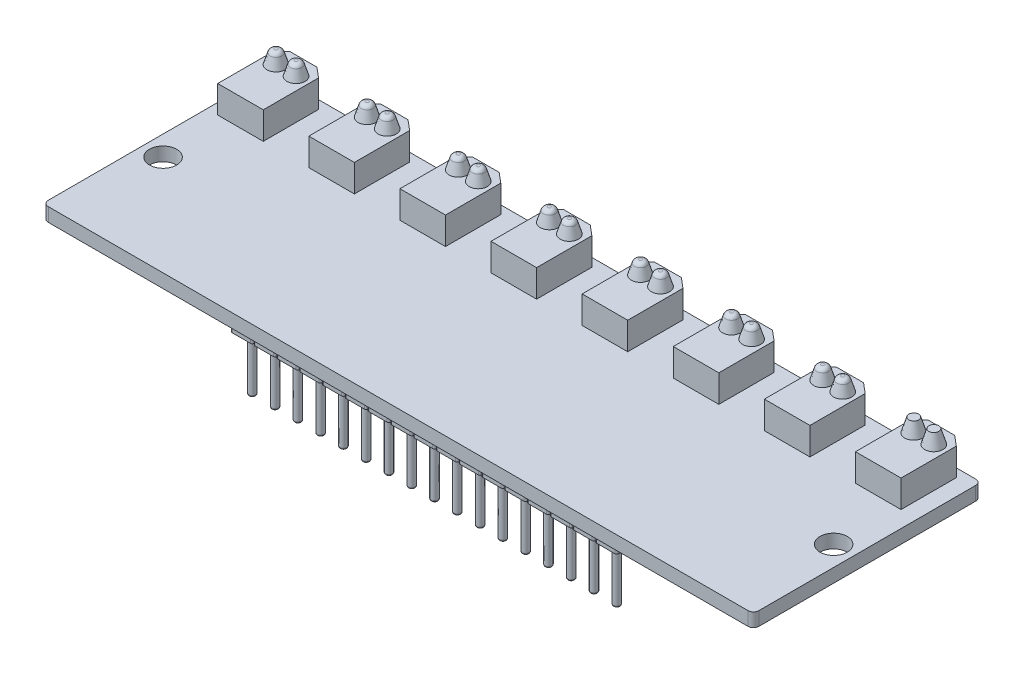
from build123d import *

# Parameters (mm, degrees)
SKETCH1_W                      = 78
SKETCH1_H                      = 25
BOSS_EXTRUDE1_DEPTH            = 1.5
FILLET1_R                      = 0.6
SKETCH2_R                      = 1.5
CUT_EXTRUDE1_DEPTH             = 1.5
BOSS_EXTRUDE2_DEPTH            = 3
SKETCH4_R                      = 1
BOSS_EXTRUDE7_DEPTH            = 1.5
BOSS_EXTRUDE7_DRAFT            = 17
BOSS_EXTRUDE7_PROFILE_2_DEPTH  = 1.5
BOSS_EXTRUDE7_PROFILE_2_DRAFT  = 17
BOSS_EXTRUDE7_PROFILE_3_DEPTH  = 1.5
BOSS_EXTRUDE7_PROFILE_3_DRAFT  = 17
BOSS_EXTRUDE7_PROFILE_4_DEPTH  = 1.5
BOSS_EXTRUDE7_PROFILE_4_DRAFT  = 17
BOSS_EXTRUDE7_PROFILE_5_DEPTH  = 1.5
BOSS_EXTRUDE7_PROFILE_5_DRAFT  = 17
BOSS_EXTRUDE7_PROFILE_6_DEPTH  = 1.5
BOSS_EXTRUDE7_PROFILE_6_DRAFT  = 17
BOSS_EXTRUDE7_PROFILE_7_DEPTH  = 1.5
BOSS_EXTRUDE7_PROFILE_7_DRAFT  = 17
BOSS_EXTRUDE7_PROFILE_8_DEPTH  = 1.5
BOSS_EXTRUDE7_PROFILE_8_DRAFT  = 17
BOSS_EXTRUDE7_PROFILE_9_DEPTH  = 1.5
BOSS_EXTRUDE7_PROFILE_9_DRAFT  = 17
BOSS_EXTRUDE7_PROFILE_10_DEPTH = 1.5
BOSS_EXTRUDE7_PROFILE_10_DRAFT = 17
BOSS_EXTRUDE7_PROFILE_11_DEPTH = 1.5
BOSS_EXTRUDE7_PROFILE_11_DRAFT = 17
BOSS_EXTRUDE7_PROFILE_12_DEPTH = 1.5
BOSS_EXTRUDE7_PROFILE_12_DRAFT = 17
BOSS_EXTRUDE7_PROFILE_13_DEPTH = 1.5
BOSS_EXTRUDE7_PROFILE_13_DRAFT = 17
BOSS_EXTRUDE7_PROFILE_14_DEPTH = 1.5
BOSS_EXTRUDE7_PROFILE_14_DRAFT = 17
BOSS_EXTRUDE7_PROFILE_15_DEPTH = 1.5
BOSS_EXTRUDE7_PROFILE_15_DRAFT = 17
BOSS_EXTRUDE7_PROFILE_16_DEPTH = 1.5
BOSS_EXTRUDE7_PROFILE_16_DRAFT = 17
FILLET4_R                      = 0.5
SKETCH5_W                      = 2.4
SKETCH5_H                      = 2.4
BOSS_EXTRUDE12_DEPTH           = 2
SKETCH6_R                      = 0.375
BOSS_EXTRUDE13_DEPTH           = 6
FILLET5_R                      = 0.2
FILLET7_R                      = 0.2
FILLET8_R                      = 0.2


with BuildPart() as part:
    # Sketch1 → Boss-Extrude1 (new body)
    with BuildSketch(Plane(origin=(0, 0, 0), x_dir=(1, 0, 0), z_dir=(0, 1, 0))):
        Rectangle(SKETCH1_W, SKETCH1_H)
    extrude(amount=BOSS_EXTRUDE1_DEPTH)

    # Fillet1
    fillet1_edges = [part.edges().sort_by_distance(p)[0] for p in [
        (39, 0.75, 12.5),
        (39, 0.75, -12.5),
        (-39, 0.75, -12.5),
        (-39, 0.75, 12.5),
    ]]
    fillet(fillet1_edges, radius=FILLET1_R)

    # Sketch2 → Cut-Extrude1 (cut)
    with BuildSketch(Plane(origin=(0, 1.5, 0), x_dir=(1, 0, 0), z_dir=(0, 1, 0))):
        with Locations((-36.8, -1.5)):
            Circle(SKETCH2_R)
        with Locations((36.8, -1.5)):
            Circle(SKETCH2_R)
    extrude(amount=-CUT_EXTRUDE1_DEPTH, mode=Mode.SUBTRACT)

    # Sketch3 → Boss-Extrude2 (add)
    with BuildSketch(Plane(origin=(0, 1.5, 0), x_dir=(1, 0, 0), z_dir=(0, 1, 0))):
        Polygon((-36.866761268, 12.5), (-33.913958089, 12.5), (-32.8, 11.566761268), (-32.8, 5.5), (-37.8, 5.5), (-37.8, 11.566761268), align=None)
        Polygon((-22.8, 11.566761268), (-22.8, 5.5), (-27.8, 5.5), (-27.8, 11.566761268), (-26.866761268, 12.5), (-23.913958089, 12.5), align=None)
        Polygon((-12.8, 11.566761268), (-12.8, 5.5), (-17.8, 5.5), (-17.8, 11.566761268), (-16.866761268, 12.5), (-13.913958089, 12.5), align=None)
        Polygon((-2.8, 11.566761268), (-2.8, 5.5), (-7.8, 5.5), (-7.8, 11.566761268), (-6.866761268, 12.5), (-3.913958089, 12.5), align=None)
        Polygon((7.2, 11.566761268), (7.2, 5.5), (2.2, 5.5), (2.2, 11.566761268), (3.133238732, 12.5), (6.086041911, 12.5), align=None)
        Polygon((17.2, 11.566761268), (17.2, 5.5), (12.2, 5.5), (12.2, 11.566761268), (13.133238732, 12.5), (16.086041911, 12.5), align=None)
        Polygon((27.2, 11.566761268), (27.2, 5.5), (22.2, 5.5), (22.2, 11.566761268), (23.133238732, 12.5), (26.086041911, 12.5), align=None)
        Polygon((37.2, 11.566761268), (37.2, 5.5), (32.2, 5.5), (32.2, 11.566761268), (33.133238732, 12.5), (36.086041911, 12.5), align=None)
    extrude(amount=BOSS_EXTRUDE2_DEPTH)


with BuildPart() as boss_extrude7_tool:
    # Sketch4 → Boss-Extrude7 (with draft: the straight prism first)
    with BuildSketch(Plane(origin=(0, 4.5, 0), x_dir=(1, 0, 0), z_dir=(0, 1, 0))):
        with Locations((-36.4, 10.499601384)):
            Circle(SKETCH4_R)
    extrude(amount=BOSS_EXTRUDE7_DEPTH)
    # Boss-Extrude7: the draft: its side faces are tilted about the plane it starts from
    boss_extrude7_sides = [boss_extrude7_tool.faces().sort_by_distance(p)[0] for p in [
        (-37.4, 5.25, -10.499601384),
    ]]
    draft(boss_extrude7_sides, Plane(origin=(0, 4.5, 0), x_dir=(1, 0, 0), z_dir=(0, 1, 0)), BOSS_EXTRUDE7_DRAFT)


with BuildPart() as part_1:
    add(part.part)

    # Boss-Extrude7: add boss_extrude7_tool
    add(boss_extrude7_tool.part)


with BuildPart() as boss_extrude7_profile_2_tool:
    # Sketch4 → Boss-Extrude7 profile 2 (with draft: the straight prism first)
    with BuildSketch(Plane(origin=(0, 4.5, 0), x_dir=(1, 0, 0), z_dir=(0, 1, 0))):
        with Locations((-34.2, 10.499601384)):
            Circle(SKETCH4_R)
    extrude(amount=BOSS_EXTRUDE7_PROFILE_2_DEPTH)
    # Boss-Extrude7 profile 2: the draft: its side faces are tilted about the plane it starts from
    boss_extrude7_profile_2_sides = [boss_extrude7_profile_2_tool.faces().sort_by_distance(p)[0] for p in [
        (-35.2, 5.25, -10.499601384),
    ]]
    draft(boss_extrude7_profile_2_sides, Plane(origin=(0, 4.5, 0), x_dir=(1, 0, 0), z_dir=(0, 1, 0)), BOSS_EXTRUDE7_PROFILE_2_DRAFT)


with BuildPart() as part_2:
    add(part_1.part)

    # Boss-Extrude7 profile 2: add boss_extrude7_profile_2_tool
    add(boss_extrude7_profile_2_tool.part)


with BuildPart() as boss_extrude7_profile_3_tool:
    # Sketch4 → Boss-Extrude7 profile 3 (with draft: the straight prism first)
    with BuildSketch(Plane(origin=(0, 4.5, 0), x_dir=(1, 0, 0), z_dir=(0, 1, 0))):
        with Locations((-26.4, 10.499601384)):
            Circle(SKETCH4_R)
    extrude(amount=BOSS_EXTRUDE7_PROFILE_3_DEPTH)
    # Boss-Extrude7 profile 3: the draft: its side faces are tilted about the plane it starts from
    boss_extrude7_profile_3_sides = [boss_extrude7_profile_3_tool.faces().sort_by_distance(p)[0] for p in [
        (-27.4, 5.25, -10.499601384),
    ]]
    draft(boss_extrude7_profile_3_sides, Plane(origin=(0, 4.5, 0), x_dir=(1, 0, 0), z_dir=(0, 1, 0)), BOSS_EXTRUDE7_PROFILE_3_DRAFT)


with BuildPart() as part_3:
    add(part_2.part)

    # Boss-Extrude7 profile 3: add boss_extrude7_profile_3_tool
    add(boss_extrude7_profile_3_tool.part)


with BuildPart() as boss_extrude7_profile_4_tool:
    # Sketch4 → Boss-Extrude7 profile 4 (with draft: the straight prism first)
    with BuildSketch(Plane(origin=(0, 4.5, 0), x_dir=(1, 0, 0), z_dir=(0, 1, 0))):
        with Locations((-24.2, 10.499601384)):
            Circle(SKETCH4_R)
    extrude(amount=BOSS_EXTRUDE7_PROFILE_4_DEPTH)
    # Boss-Extrude7 profile 4: the draft: its side faces are tilted about the plane it starts from
    boss_extrude7_profile_4_sides = [boss_extrude7_profile_4_tool.faces().sort_by_distance(p)[0] for p in [
        (-25.2, 5.25, -10.499601384),
    ]]
    draft(boss_extrude7_profile_4_sides, Plane(origin=(0, 4.5, 0), x_dir=(1, 0, 0), z_dir=(0, 1, 0)), BOSS_EXTRUDE7_PROFILE_4_DRAFT)


with BuildPart() as part_4:
    add(part_3.part)

    # Boss-Extrude7 profile 4: add boss_extrude7_profile_4_tool
    add(boss_extrude7_profile_4_tool.part)


with BuildPart() as boss_extrude7_profile_5_tool:
    # Sketch4 → Boss-Extrude7 profile 5 (with draft: the straight prism first)
    with BuildSketch(Plane(origin=(0, 4.5, 0), x_dir=(1, 0, 0), z_dir=(0, 1, 0))):
        with Locations((-16.4, 10.499601384)):
            Circle(SKETCH4_R)
    extrude(amount=BOSS_EXTRUDE7_PROFILE_5_DEPTH)
    # Boss-Extrude7 profile 5: the draft: its side faces are tilted about the plane it starts from
    boss_extrude7_profile_5_sides = [boss_extrude7_profile_5_tool.faces().sort_by_distance(p)[0] for p in [
        (-17.4, 5.25, -10.499601384),
    ]]
    draft(boss_extrude7_profile_5_sides, Plane(origin=(0, 4.5, 0), x_dir=(1, 0, 0), z_dir=(0, 1, 0)), BOSS_EXTRUDE7_PROFILE_5_DRAFT)


with BuildPart() as part_5:
    add(part_4.part)

    # Boss-Extrude7 profile 5: add boss_extrude7_profile_5_tool
    add(boss_extrude7_profile_5_tool.part)


with BuildPart() as boss_extrude7_profile_6_tool:
    # Sketch4 → Boss-Extrude7 profile 6 (with draft: the straight prism first)
    with BuildSketch(Plane(origin=(0, 4.5, 0), x_dir=(1, 0, 0), z_dir=(0, 1, 0))):
        with Locations((-14.2, 10.499601384)):
            Circle(SKETCH4_R)
    extrude(amount=BOSS_EXTRUDE7_PROFILE_6_DEPTH)
    # Boss-Extrude7 profile 6: the draft: its side faces are tilted about the plane it starts from
    boss_extrude7_profile_6_sides = [boss_extrude7_profile_6_tool.faces().sort_by_distance(p)[0] for p in [
        (-15.2, 5.25, -10.499601384),
    ]]
    draft(boss_extrude7_profile_6_sides, Plane(origin=(0, 4.5, 0), x_dir=(1, 0, 0), z_dir=(0, 1, 0)), BOSS_EXTRUDE7_PROFILE_6_DRAFT)


with BuildPart() as part_6:
    add(part_5.part)

    # Boss-Extrude7 profile 6: add boss_extrude7_profile_6_tool
    add(boss_extrude7_profile_6_tool.part)


with BuildPart() as boss_extrude7_profile_7_tool:
    # Sketch4 → Boss-Extrude7 profile 7 (with draft: the straight prism first)
    with BuildSketch(Plane(origin=(0, 4.5, 0), x_dir=(1, 0, 0), z_dir=(0, 1, 0))):
        with Locations((-6.4, 10.499601384)):
            Circle(SKETCH4_R)
    extrude(amount=BOSS_EXTRUDE7_PROFILE_7_DEPTH)
    # Boss-Extrude7 profile 7: the draft: its side faces are tilted about the plane it starts from
    boss_extrude7_profile_7_sides = [boss_extrude7_profile_7_tool.faces().sort_by_distance(p)[0] for p in [
        (-7.4, 5.25, -10.499601384),
    ]]
    draft(boss_extrude7_profile_7_sides, Plane(origin=(0, 4.5, 0), x_dir=(1, 0, 0), z_dir=(0, 1, 0)), BOSS_EXTRUDE7_PROFILE_7_DRAFT)


with BuildPart() as part_7:
    add(part_6.part)

    # Boss-Extrude7 profile 7: add boss_extrude7_profile_7_tool
    add(boss_extrude7_profile_7_tool.part)


with BuildPart() as boss_extrude7_profile_8_tool:
    # Sketch4 → Boss-Extrude7 profile 8 (with draft: the straight prism first)
    with BuildSketch(Plane(origin=(0, 4.5, 0), x_dir=(1, 0, 0), z_dir=(0, 1, 0))):
        with Locations((-4.2, 10.499601384)):
            Circle(SKETCH4_R)
    extrude(amount=BOSS_EXTRUDE7_PROFILE_8_DEPTH)
    # Boss-Extrude7 profile 8: the draft: its side faces are tilted about the plane it starts from
    boss_extrude7_profile_8_sides = [boss_extrude7_profile_8_tool.faces().sort_by_distance(p)[0] for p in [
        (-5.2, 5.25, -10.499601384),
    ]]
    draft(boss_extrude7_profile_8_sides, Plane(origin=(0, 4.5, 0), x_dir=(1, 0, 0), z_dir=(0, 1, 0)), BOSS_EXTRUDE7_PROFILE_8_DRAFT)


with BuildPart() as part_8:
    add(part_7.part)

    # Boss-Extrude7 profile 8: add boss_extrude7_profile_8_tool
    add(boss_extrude7_profile_8_tool.part)


with BuildPart() as boss_extrude7_profile_9_tool:
    # Sketch4 → Boss-Extrude7 profile 9 (with draft: the straight prism first)
    with BuildSketch(Plane(origin=(0, 4.5, 0), x_dir=(1, 0, 0), z_dir=(0, 1, 0))):
        with Locations((3.6, 10.499601384)):
            Circle(SKETCH4_R)
    extrude(amount=BOSS_EXTRUDE7_PROFILE_9_DEPTH)
    # Boss-Extrude7 profile 9: the draft: its side faces are tilted about the plane it starts from
    boss_extrude7_profile_9_sides = [boss_extrude7_profile_9_tool.faces().sort_by_distance(p)[0] for p in [
        (2.6, 5.25, -10.499601384),
    ]]
    draft(boss_extrude7_profile_9_sides, Plane(origin=(0, 4.5, 0), x_dir=(1, 0, 0), z_dir=(0, 1, 0)), BOSS_EXTRUDE7_PROFILE_9_DRAFT)


with BuildPart() as part_9:
    add(part_8.part)

    # Boss-Extrude7 profile 9: add boss_extrude7_profile_9_tool
    add(boss_extrude7_profile_9_tool.part)


with BuildPart() as boss_extrude7_profile_10_tool:
    # Sketch4 → Boss-Extrude7 profile 10 (with draft: the straight prism first)
    with BuildSketch(Plane(origin=(0, 4.5, 0), x_dir=(1, 0, 0), z_dir=(0, 1, 0))):
        with Locations((5.8, 10.499601384)):
            Circle(SKETCH4_R)
    extrude(amount=BOSS_EXTRUDE7_PROFILE_10_DEPTH)
    # Boss-Extrude7 profile 10: the draft: its side faces are tilted about the plane it starts from
    boss_extrude7_profile_10_sides = [boss_extrude7_profile_10_tool.faces().sort_by_distance(p)[0] for p in [
        (4.8, 5.25, -10.499601384),
    ]]
    draft(boss_extrude7_profile_10_sides, Plane(origin=(0, 4.5, 0), x_dir=(1, 0, 0), z_dir=(0, 1, 0)), BOSS_EXTRUDE7_PROFILE_10_DRAFT)


with BuildPart() as part_10:
    add(part_9.part)

    # Boss-Extrude7 profile 10: add boss_extrude7_profile_10_tool
    add(boss_extrude7_profile_10_tool.part)


with BuildPart() as boss_extrude7_profile_11_tool:
    # Sketch4 → Boss-Extrude7 profile 11 (with draft: the straight prism first)
    with BuildSketch(Plane(origin=(0, 4.5, 0), x_dir=(1, 0, 0), z_dir=(0, 1, 0))):
        with Locations((13.6, 10.499601384)):
            Circle(SKETCH4_R)
    extrude(amount=BOSS_EXTRUDE7_PROFILE_11_DEPTH)
    # Boss-Extrude7 profile 11: the draft: its side faces are tilted about the plane it starts from
    boss_extrude7_profile_11_sides = [boss_extrude7_profile_11_tool.faces().sort_by_distance(p)[0] for p in [
        (12.6, 5.25, -10.499601384),
    ]]
    draft(boss_extrude7_profile_11_sides, Plane(origin=(0, 4.5, 0), x_dir=(1, 0, 0), z_dir=(0, 1, 0)), BOSS_EXTRUDE7_PROFILE_11_DRAFT)


with BuildPart() as part_11:
    add(part_10.part)

    # Boss-Extrude7 profile 11: add boss_extrude7_profile_11_tool
    add(boss_extrude7_profile_11_tool.part)


with BuildPart() as boss_extrude7_profile_12_tool:
    # Sketch4 → Boss-Extrude7 profile 12 (with draft: the straight prism first)
    with BuildSketch(Plane(origin=(0, 4.5, 0), x_dir=(1, 0, 0), z_dir=(0, 1, 0))):
        with Locations((15.8, 10.499601384)):
            Circle(SKETCH4_R)
    extrude(amount=BOSS_EXTRUDE7_PROFILE_12_DEPTH)
    # Boss-Extrude7 profile 12: the draft: its side faces are tilted about the plane it starts from
    boss_extrude7_profile_12_sides = [boss_extrude7_profile_12_tool.faces().sort_by_distance(p)[0] for p in [
        (14.8, 5.25, -10.499601384),
    ]]
    draft(boss_extrude7_profile_12_sides, Plane(origin=(0, 4.5, 0), x_dir=(1, 0, 0), z_dir=(0, 1, 0)), BOSS_EXTRUDE7_PROFILE_12_DRAFT)


with BuildPart() as part_12:
    add(part_11.part)

    # Boss-Extrude7 profile 12: add boss_extrude7_profile_12_tool
    add(boss_extrude7_profile_12_tool.part)


with BuildPart() as boss_extrude7_profile_13_tool:
    # Sketch4 → Boss-Extrude7 profile 13 (with draft: the straight prism first)
    with BuildSketch(Plane(origin=(0, 4.5, 0), x_dir=(1, 0, 0), z_dir=(0, 1, 0))):
        with Locations((23.6, 10.499601384)):
            Circle(SKETCH4_R)
    extrude(amount=BOSS_EXTRUDE7_PROFILE_13_DEPTH)
    # Boss-Extrude7 profile 13: the draft: its side faces are tilted about the plane it starts from
    boss_extrude7_profile_13_sides = [boss_extrude7_profile_13_tool.faces().sort_by_distance(p)[0] for p in [
        (22.6, 5.25, -10.499601384),
    ]]
    draft(boss_extrude7_profile_13_sides, Plane(origin=(0, 4.5, 0), x_dir=(1, 0, 0), z_dir=(0, 1, 0)), BOSS_EXTRUDE7_PROFILE_13_DRAFT)


with BuildPart() as part_13:
    add(part_12.part)

    # Boss-Extrude7 profile 13: add boss_extrude7_profile_13_tool
    add(boss_extrude7_profile_13_tool.part)


with BuildPart() as boss_extrude7_profile_14_tool:
    # Sketch4 → Boss-Extrude7 profile 14 (with draft: the straight prism first)
    with BuildSketch(Plane(origin=(0, 4.5, 0), x_dir=(1, 0, 0), z_dir=(0, 1, 0))):
        with Locations((25.8, 10.499601384)):
            Circle(SKETCH4_R)
    extrude(amount=BOSS_EXTRUDE7_PROFILE_14_DEPTH)
    # Boss-Extrude7 profile 14: the draft: its side faces are tilted about the plane it starts from
    boss_extrude7_profile_14_sides = [boss_extrude7_profile_14_tool.faces().sort_by_distance(p)[0] for p in [
        (24.8, 5.25, -10.499601384),
    ]]
    draft(boss_extrude7_profile_14_sides, Plane(origin=(0, 4.5, 0), x_dir=(1, 0, 0), z_dir=(0, 1, 0)), BOSS_EXTRUDE7_PROFILE_14_DRAFT)


with BuildPart() as part_14:
    add(part_13.part)

    # Boss-Extrude7 profile 14: add boss_extrude7_profile_14_tool
    add(boss_extrude7_profile_14_tool.part)


with BuildPart() as boss_extrude7_profile_15_tool:
    # Sketch4 → Boss-Extrude7 profile 15 (with draft: the straight prism first)
    with BuildSketch(Plane(origin=(0, 4.5, 0), x_dir=(1, 0, 0), z_dir=(0, 1, 0))):
        with Locations((33.6, 10.499601384)):
            Circle(SKETCH4_R)
    extrude(amount=BOSS_EXTRUDE7_PROFILE_15_DEPTH)
    # Boss-Extrude7 profile 15: the draft: its side faces are tilted about the plane it starts from
    boss_extrude7_profile_15_sides = [boss_extrude7_profile_15_tool.faces().sort_by_distance(p)[0] for p in [
        (32.6, 5.25, -10.499601384),
    ]]
    draft(boss_extrude7_profile_15_sides, Plane(origin=(0, 4.5, 0), x_dir=(1, 0, 0), z_dir=(0, 1, 0)), BOSS_EXTRUDE7_PROFILE_15_DRAFT)


with BuildPart() as part_15:
    add(part_14.part)

    # Boss-Extrude7 profile 15: add boss_extrude7_profile_15_tool
    add(boss_extrude7_profile_15_tool.part)


with BuildPart() as boss_extrude7_profile_16_tool:
    # Sketch4 → Boss-Extrude7 profile 16 (with draft: the straight prism first)
    with BuildSketch(Plane(origin=(0, 4.5, 0), x_dir=(1, 0, 0), z_dir=(0, 1, 0))):
        with Locations((35.8, 10.499601384)):
            Circle(SKETCH4_R)
    extrude(amount=BOSS_EXTRUDE7_PROFILE_16_DEPTH)
    # Boss-Extrude7 profile 16: the draft: its side faces are tilted about the plane it starts from
    boss_extrude7_profile_16_sides = [boss_extrude7_profile_16_tool.faces().sort_by_distance(p)[0] for p in [
        (34.8, 5.25, -10.499601384),
    ]]
    draft(boss_extrude7_profile_16_sides, Plane(origin=(0, 4.5, 0), x_dir=(1, 0, 0), z_dir=(0, 1, 0)), BOSS_EXTRUDE7_PROFILE_16_DRAFT)


with BuildPart() as part_16:
    add(part_15.part)

    # Boss-Extrude7 profile 16: add boss_extrude7_profile_16_tool
    add(boss_extrude7_profile_16_tool.part)

    # Fillet4
    fillet4_edges = [part_16.edges().sort_by_distance(p)[0] for p in [
        (-36.941403978, 6, -10.499601384),
        (-34.741403978, 6, -10.499601384),
        (-26.941403978, 6, -10.499601384),
        (-24.741403978, 6, -10.499601384),
        (-16.941403978, 6, -10.499601384),
        (-14.741403978, 6, -10.499601384),
        (-6.941403978, 6, -10.499601384),
        (-4.741403978, 6, -10.499601384),
        (25.258596022, 6, -10.499601384),
        (23.058596022, 6, -10.499601384),
        (15.258596022, 6, -10.499601384),
        (13.058596022, 6, -10.499601384),
        (5.258596022, 6, -10.499601384),
        (3.058596022, 6, -10.499601384),
    ]]
    fillet(fillet4_edges, radius=FILLET4_R)

    # Sketch5 → Boss-Extrude12 (add)
    with BuildSketch(Plane.XZ):
        with Locations((-18.8, 9.7)):
            Rectangle(SKETCH5_W, SKETCH5_H)
        with Locations((-16.3, 9.7)):
            Rectangle(SKETCH5_W, SKETCH5_H)
        with Locations((-13.8, 9.7)):
            Rectangle(SKETCH5_W, SKETCH5_H)
        with Locations((-11.3, 9.7)):
            Rectangle(SKETCH5_W, SKETCH5_H)
        with Locations((-8.8, 9.7)):
            Rectangle(SKETCH5_W, SKETCH5_H)
        with Locations((-6.3, 9.7)):
            Rectangle(SKETCH5_W, SKETCH5_H)
        with Locations((-3.8, 9.7)):
            Rectangle(SKETCH5_W, SKETCH5_H)
        with Locations((-1.3, 9.7)):
            Rectangle(SKETCH5_W, SKETCH5_H)
        with Locations((1.2, 9.7)):
            Rectangle(SKETCH5_W, SKETCH5_H)
        with Locations((3.7, 9.7)):
            Rectangle(SKETCH5_W, SKETCH5_H)
        with Locations((6.2, 9.7)):
            Rectangle(SKETCH5_W, SKETCH5_H)
        with Locations((8.7, 9.7)):
            Rectangle(SKETCH5_W, SKETCH5_H)
        with Locations((11.2, 9.7)):
            Rectangle(SKETCH5_W, SKETCH5_H)
        with Locations((13.7, 9.7)):
            Rectangle(SKETCH5_W, SKETCH5_H)
        with Locations((16.2, 9.7)):
            Rectangle(SKETCH5_W, SKETCH5_H)
        with Locations((18.7, 9.7)):
            Rectangle(SKETCH5_W, SKETCH5_H)
        with Locations((21.2, 9.7)):
            Rectangle(SKETCH5_W, SKETCH5_H)
    extrude(amount=BOSS_EXTRUDE12_DEPTH)

    # Sketch6 → Boss-Extrude13 (add)
    with BuildSketch(Plane.XZ.offset(2)):
        with Locations((-18.8, 9.7)):
            Circle(SKETCH6_R)
        with Locations((-16.3, 9.7)):
            Circle(SKETCH6_R)
        with Locations((-13.8, 9.7)):
            Circle(SKETCH6_R)
        with Locations((-11.3, 9.7)):
            Circle(SKETCH6_R)
        with Locations((-8.8, 9.7)):
            Circle(SKETCH6_R)
        with Locations((-6.3, 9.7)):
            Circle(SKETCH6_R)
        with Locations((-3.8, 9.7)):
            Circle(SKETCH6_R)
        with Locations((-1.3, 9.7)):
            Circle(SKETCH6_R)
        with Locations((1.2, 9.7)):
            Circle(SKETCH6_R)
        with Locations((3.7, 9.7)):
            Circle(SKETCH6_R)
        with Locations((6.2, 9.7)):
            Circle(SKETCH6_R)
        with Locations((8.7, 9.7)):
            Circle(SKETCH6_R)
        with Locations((11.2, 9.7)):
            Circle(SKETCH6_R)
        with Locations((13.7, 9.7)):
            Circle(SKETCH6_R)
        with Locations((16.2, 9.7)):
            Circle(SKETCH6_R)
        with Locations((18.7, 9.7)):
            Circle(SKETCH6_R)
        with Locations((21.2, 9.7)):
            Circle(SKETCH6_R)
    extrude(amount=BOSS_EXTRUDE13_DEPTH)

    # Fillet5
    fillet5_edges = [part_16.edges().sort_by_distance(p)[0] for p in [
        (-17.6, -1, 10.9),
        (-17.6, -1, 8.5),
        (-20, -1, 8.5),
        (-20, -1, 10.9),
    ]]
    fillet(fillet5_edges, radius=FILLET5_R)

    # Fillet7
    fillet7_edges = [part_16.edges().sort_by_distance(p)[0] for p in [
        (22.4, -1, 8.5),
        (20, -1, 8.5),
        (19.9, -1, 8.5),
        (17.5, -1, 8.5),
        (17.4, -1, 8.5),
        (15, -1, 8.5),
        (14.9, -1, 8.5),
        (12.5, -1, 8.5),
        (12.4, -1, 8.5),
        (10, -1, 8.5),
        (9.9, -1, 8.5),
        (7.5, -1, 8.5),
        (7.4, -1, 8.5),
        (5, -1, 8.5),
        (4.9, -1, 8.5),
        (2.5, -1, 8.5),
        (2.4, -1, 8.5),
        (0, -1, 8.5),
        (-0.1, -1, 8.5),
        (-2.5, -1, 8.5),
        (-2.6, -1, 8.5),
        (-5, -1, 8.5),
        (-5.1, -1, 8.5),
        (-7.5, -1, 8.5),
        (-7.6, -1, 8.5),
        (-10, -1, 8.5),
        (-10.1, -1, 8.5),
        (-12.5, -1, 8.5),
        (-12.6, -1, 8.5),
        (-15, -1, 8.5),
        (-15.1, -1, 8.5),
        (-17.5, -1, 8.5),
        (22.4, -1, 10.9),
        (20, -1, 10.9),
        (19.9, -1, 10.9),
        (17.5, -1, 10.9),
        (17.4, -1, 10.9),
        (15, -1, 10.9),
        (14.9, -1, 10.9),
        (12.5, -1, 10.9),
        (12.4, -1, 10.9),
        (10, -1, 10.9),
        (9.9, -1, 10.9),
        (7.5, -1, 10.9),
        (7.4, -1, 10.9),
        (5, -1, 10.9),
        (4.9, -1, 10.9),
        (2.5, -1, 10.9),
        (2.4, -1, 10.9),
        (0, -1, 10.9),
        (-0.1, -1, 10.9),
        (-2.5, -1, 10.9),
        (-2.6, -1, 10.9),
        (-5, -1, 10.9),
        (-5.1, -1, 10.9),
        (-7.5, -1, 10.9),
        (-7.6, -1, 10.9),
        (-10, -1, 10.9),
        (-10.1, -1, 10.9),
        (-12.5, -1, 10.9),
        (-12.6, -1, 10.9),
        (-15, -1, 10.9),
        (-15.1, -1, 10.9),
        (-17.5, -1, 10.9),
    ]]
    fillet(fillet7_edges, radius=FILLET7_R)

    # Fillet8
    fillet8_edges = [part_16.edges().sort_by_distance(p)[0] for p in [
        (20.825, -8, 9.7),
        (18.325, -8, 9.7),
        (15.825, -8, 9.7),
        (13.325, -8, 9.7),
        (10.825, -8, 9.7),
        (8.325, -8, 9.7),
        (5.825, -8, 9.7),
        (3.325, -8, 9.7),
        (0.825, -8, 9.7),
        (-1.675, -8, 9.7),
        (-4.175, -8, 9.7),
        (-6.675, -8, 9.7),
        (-9.175, -8, 9.7),
        (-11.675, -8, 9.7),
        (-14.175, -8, 9.7),
        (-16.675, -8, 9.7),
        (-19.175, -8, 9.7),
    ]]
    fillet(fillet8_edges, radius=FILLET8_R)


solid = part_16.part
